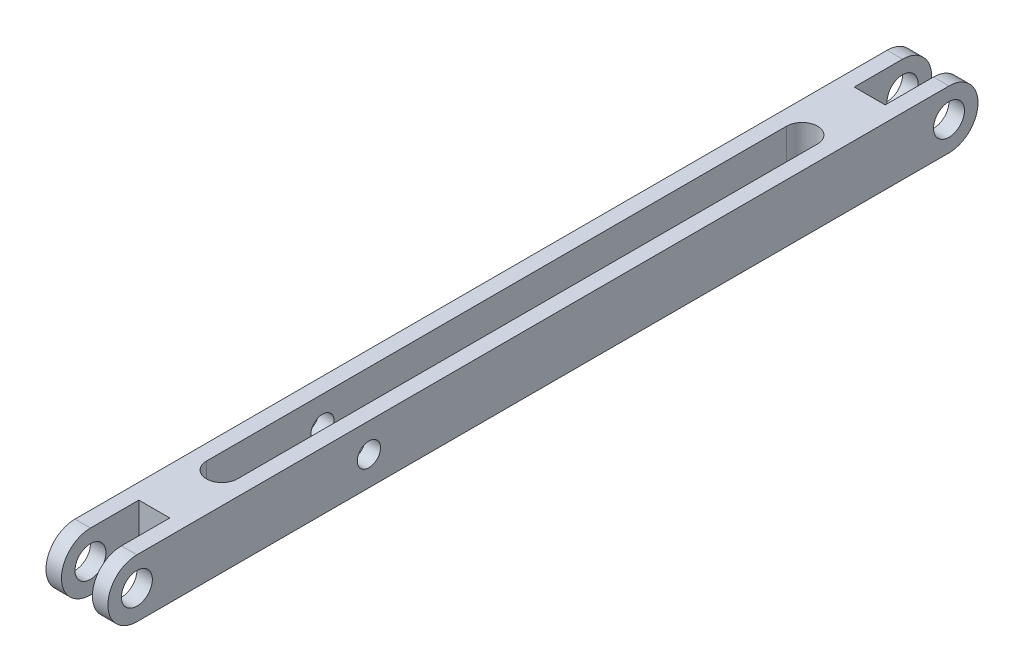
from build123d import *

# Parameters (mm, degrees)
EXTRUDE_1_DEPTH     = 16
SKETCH_3_W          = 8
SKETCH_3_H          = 20
CUT_EXTRUDE_1_DEPTH = 115.617843288
SKETCH_4_R          = 4
CUT_EXTRUDE_2_DEPTH = 114.879322091
CUT_EXTRUDE_3_DEPTH = 115.617843288
SKETCH_6_R          = 3
CUT_EXTRUDE_4_DEPTH = 114.879322091


with BuildPart() as part:
    # 草图2 → 凸台-拉伸1 (new body)
    with BuildSketch(Plane(origin=(0, 0, 0), x_dir=(0, 0, -1), z_dir=(1, 0, 0))):
        with BuildLine():
            Line((-105, -7.5), (105, -7.5))
            ThreePointArc((105, -7.5), (112.5, 0), (105, 7.5))
            Line((105, 7.5), (-105, 7.5))
            ThreePointArc((-105, 7.5), (-112.5, 0), (-105, -7.5))
        make_face()
    extrude(amount=EXTRUDE_1_DEPTH)

    # 草图3 → 切除-拉伸1 (cut, through all)
    with BuildSketch(Plane(origin=(0, 7.5, 0), x_dir=(1, 0, 0), z_dir=(0, 1, 0))):
        with Locations((8, -102.5)):
            Rectangle(SKETCH_3_W, SKETCH_3_H)
        with Locations((8, 102.5)):
            Rectangle(SKETCH_3_W, SKETCH_3_H)
    extrude(amount=-CUT_EXTRUDE_1_DEPTH, mode=Mode.SUBTRACT)

    # 草图4 → 切除-拉伸2 (cut, through all)
    with BuildSketch(Plane(origin=(16, 0, 0), x_dir=(0, 0, -1), z_dir=(1, 0, 0))):
        with Locations((-105, 0)):
            Circle(SKETCH_4_R)
        with Locations((105, 0)):
            Circle(SKETCH_4_R)
    extrude(amount=-CUT_EXTRUDE_2_DEPTH, mode=Mode.SUBTRACT)

    # 草图5 → 切除-拉伸3 (cut, through all)
    with BuildSketch(Plane.XZ.offset(7.5)):
        with BuildLine():
            Line((12, 75), (12, -75))
            ThreePointArc((12, -75), (8, -79), (4, -75))
            Line((4, -75), (4, 75))
            ThreePointArc((4, 75), (8, 79), (12, 75))
        make_face()
    extrude(amount=-CUT_EXTRUDE_3_DEPTH, mode=Mode.SUBTRACT)

    # 草图6 → 切除-拉伸4 (cut, through all)
    with BuildSketch(Plane.ZY):
        with Locations((45, 0)):
            Circle(SKETCH_6_R)
    extrude(amount=-CUT_EXTRUDE_4_DEPTH, mode=Mode.SUBTRACT)


solid = part.part
